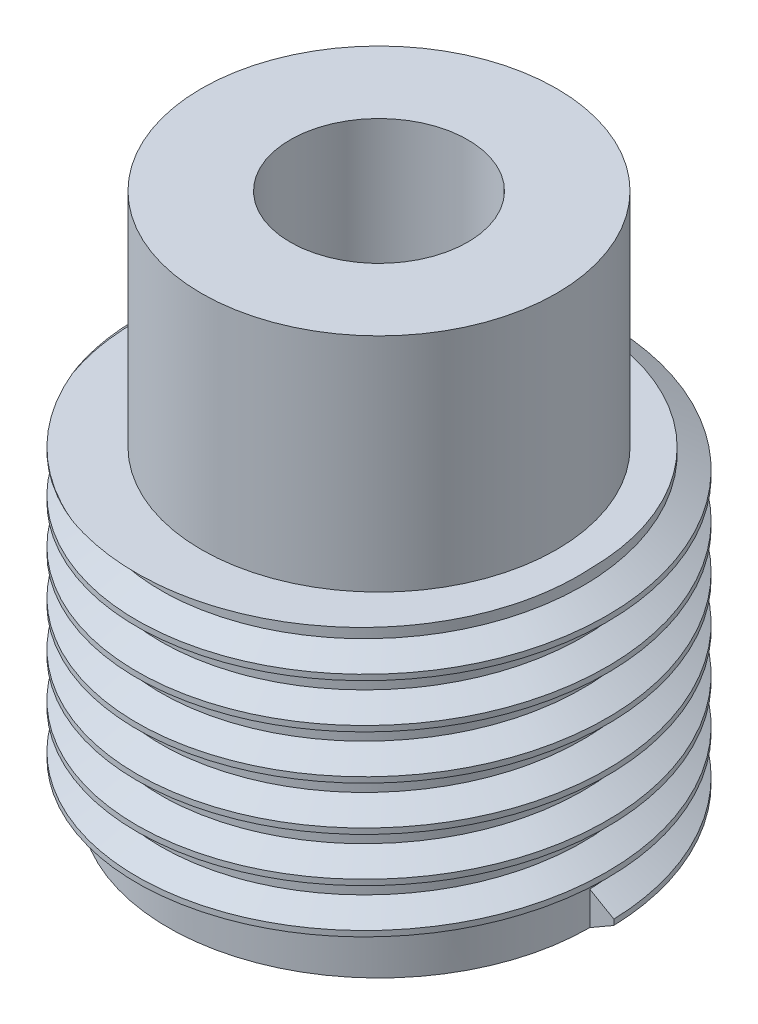
from build123d import *
from build123d.topology import SkipClean

# Parameters (mm, degrees)
CROQUIS1_R              = 9.5
SALIENTE_EXTRUIR1_DEPTH = 14
CROQUIS2_R              = 8
SALIENTE_EXTRUIR2_DEPTH = 10
CROQUIS3_R              = 4
CORTAR_EXTRUIR1_DEPTH   = 28
ROSCA1_PITCH            = 2
CROQUIS6_R              = 12.5
CROQUIS6_R_2            = 8
CORTAR_EXTRUIR2_DEPTH   = 28
CROQUIS7_R              = 2
CORTAR_EXTRUIR3_DEPTH   = 3


with BuildPart() as part:
    # Croquis1 → Saliente-Extruir1 (new body)
    with BuildSketch(Plane(origin=(0, 0, 0), x_dir=(1, 0, 0), z_dir=(0, 1, 0))):
        with Locations(Location((0, 0, 0), (0, 0, 270))):
            Circle(CROQUIS1_R)
    extrude(amount=SALIENTE_EXTRUIR1_DEPTH)

    # Croquis2 → Saliente-Extruir2 (add)
    with BuildSketch(Plane(origin=(0, 14, 0), x_dir=(1, 0, 0), z_dir=(0, 1, 0))):
        with Locations(Location((0, 0, 0), (0, 0, 270))):
            Circle(CROQUIS2_R)
    extrude(amount=SALIENTE_EXTRUIR2_DEPTH)

    # Croquis3 → Cortar-Extruir1 (cut)
    with BuildSketch(Plane(origin=(0, 24, 0), x_dir=(1, 0, 0), z_dir=(0, 1, 0))):
        with Locations(Location((0, 0, 0), (0, 0, 270))):
            Circle(CROQUIS3_R)
    extrude(amount=-CORTAR_EXTRUIR1_DEPTH, mode=Mode.SUBTRACT)

    # Rosca1: the profile of Perfil de rosca1 profile screwed along a right-hand helix of 7 turns, 10 arcs to a turn; built about Z, then put on its axis
    with SkipClean():  # the faces are left unmerged after this step: merging them gives an invalid solid
        rosca1_z = Axis((0, 0, 0), (0, 0, 1))
        rosca1_corners = [(9.4997, 0, -0.000173205), (10.58253175, 0, 0.624999997), (10.58253175, 0, 0.874999997), (9.4997, 0, 1.5001732)]
        with BuildLine(mode=Mode.PRIVATE) as rosca1_profile:
            Line(rosca1_corners[0], rosca1_corners[1])
            Line(rosca1_corners[1], rosca1_corners[2])
            Line(rosca1_corners[2], rosca1_corners[3])
            Line(rosca1_corners[3], rosca1_corners[0])
        rosca1_cap = Face(rosca1_profile.wire())
        rosca1_turn_angles = [0, 18, 36, 54, 72, 90, 108, 126, 144, 162, 180, 198, 216, 234, 252, 270, 288, 306, 324, 342, 360]
        rosca1_turn_weights = [1, 0.9510565162951535, 1, 0.9510565162951535, 1, 0.9510565162951535, 1, 0.9510565162951535, 1, 0.9510565162951535, 1, 0.9510565162951535, 1, 0.9510565162951535, 1, 0.9510565162951535, 1, 0.9510565162951535, 1, 0.9510565162951535, 1]
        rosca1_turn_rails = [Edge.make_bspline([Vector(p[0], p[1], 0).rotate(rosca1_z, rosca1_turn_angles[k]) / rosca1_turn_weights[k] + Vector(0, 0, p[2] + ROSCA1_PITCH * rosca1_turn_angles[k] / 360) for k in range(21)], [0, 0, 0, 1, 1, 2, 2, 3, 3, 4, 4, 5, 5, 6, 6, 7, 7, 8, 8, 9, 9, 10, 10, 10], 2, rosca1_turn_weights) for p in rosca1_corners]
        rosca1_turn_sides = [Face.make_surface_from_curves(rosca1_turn_rails[p[0]], rosca1_turn_rails[p[1]]) for p in [(0, 1), (1, 2), (2, 3), (3, 0)]]
        rosca1 = Plane(origin=(0, 0, 0), x_dir=(1, 0, 0), z_dir=(0, 1, 0)) * Solid(Shell([*[p.moved(Location((0, 0, ROSCA1_PITCH * i))) for i in range(7) for p in rosca1_turn_sides], rosca1_cap, rosca1_cap.rotate(rosca1_z, 2520).moved(Location((0, 0, ROSCA1_PITCH * 2520 / 360)))]))
        add(rosca1)

    # Croquis6 → Cortar-Extruir2 (cut)
    with SkipClean():  # the faces are left unmerged after this step: merging them gives an invalid solid
        with BuildSketch(Plane(origin=(0, 14, 0), x_dir=(1, 0, 0), z_dir=(0, 1, 0))):
            Circle(CROQUIS6_R)
            with Locations(Location((0, 0, 0), (0, 0, 270))):
                Circle(CROQUIS6_R_2, mode=Mode.SUBTRACT)
        extrude(amount=CORTAR_EXTRUIR2_DEPTH, mode=Mode.SUBTRACT)

    # Croquis7 → Cortar-Extruir3 (cut)
    with SkipClean():  # the faces are left unmerged after this step: merging them gives an invalid solid
        with BuildSketch(Plane.XZ):
            with Locations(Location((0, 7, 0), (0, 0, 270))):
                Circle(CROQUIS7_R)
            with Locations(Location((0, -7, 0), (0, 0, 270))):
                Circle(CROQUIS7_R)
        extrude(amount=-CORTAR_EXTRUIR3_DEPTH, mode=Mode.SUBTRACT)


solid = part.part
